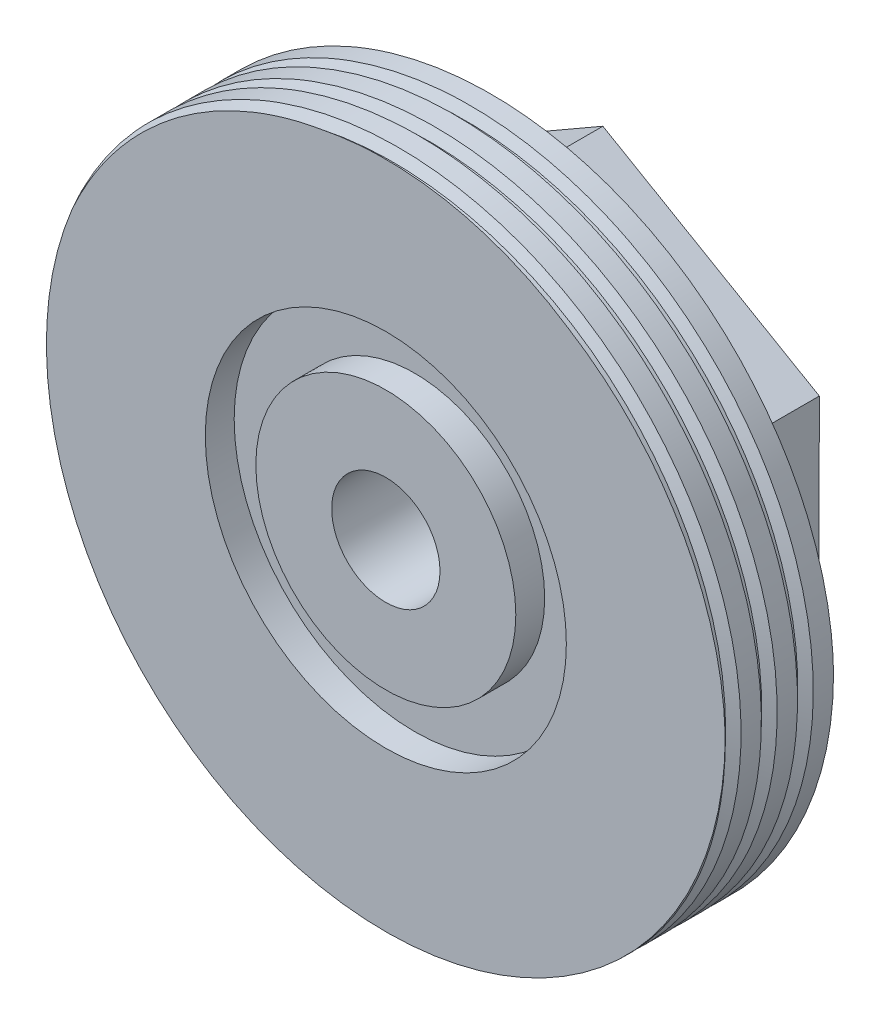
from build123d import *

# Parameters (mm, degrees)
SKETCH3_R           = 14.9225
BOSS_EXTRUDE1_DEPTH = 9.525
SKETCH11_R          = 2.38125
CUT_EXTRUDE3_DEPTH  = 6.35
SKETCH12_R          = 7.9375
SKETCH12_R_2        = 5.715
CUT_EXTRUDE4_DEPTH  = 1.27
THREAD1_PITCH       = 1.5875
CUT_EXTRUDE5_START  = -6.35
SKETCH13_R          = 2.38125
CUT_EXTRUDE5_DEPTH  = 6.35
CUT_EXTRUDE6_START  = -4.7625
SKETCH14_R          = 14.9225
CUT_EXTRUDE6_DEPTH  = 4.7625


with BuildPart() as part:
    # Sketch3 → Boss-Extrude1 (new body)
    with BuildSketch(Plane.XY):
        with Locations((8.347593151, 27.723781851)):
            Circle(SKETCH3_R)
    extrude(amount=-BOSS_EXTRUDE1_DEPTH)

    # Sketch11 → Cut-Extrude3 (cut)
    with BuildSketch(Plane.XY):
        with Locations((8.347593151, 27.723781851)):
            Circle(SKETCH11_R)
    extrude(amount=-CUT_EXTRUDE3_DEPTH, mode=Mode.SUBTRACT)

    # Sketch12 → Cut-Extrude4 (cut)
    with BuildSketch(Plane.XY):
        with Locations((8.347593151, 27.723781851)):
            Circle(SKETCH12_R)
        with Locations((8.347593151, 27.723781851)):
            Circle(SKETCH12_R_2, mode=Mode.SUBTRACT)
    extrude(amount=-CUT_EXTRUDE4_DEPTH, mode=Mode.SUBTRACT)

    # Thread1: the profile of Thread Profile1 profile screwed along a right-hand helix of 4.8 turns, 8 arcs to a turn; built about Z, then put on its axis
    thread1_z = Axis((0, 0, 0), (0, 0, 1))
    thread1_corners = [(14.9228, 0, -0.000173205), (14.9228, 0, 0.694704453), (14.492870212, 0, 0.446484374), (14.492870212, 0, 0.248046874)]
    with BuildLine(mode=Mode.PRIVATE) as thread1_profile:
        Line(thread1_corners[0], thread1_corners[1])
        Line(thread1_corners[1], thread1_corners[2])
        Line(thread1_corners[2], thread1_corners[3])
        Line(thread1_corners[3], thread1_corners[0])
    thread1_cap = Face(thread1_profile.wire())
    thread1_turn_angles = [0, 22.5, 45, 67.5, 90, 112.5, 135, 157.5, 180, 202.5, 225, 247.5, 270, 292.5, 315, 337.5, 360]
    thread1_turn_weights = [1, 0.9238795325112867, 1, 0.9238795325112867, 1, 0.9238795325112867, 1, 0.9238795325112867, 1, 0.9238795325112867, 1, 0.9238795325112867, 1, 0.9238795325112867, 1, 0.9238795325112867, 1]
    thread1_turn_rails = [Edge.make_bspline([Vector(p[0], p[1], 0).rotate(thread1_z, thread1_turn_angles[k]) / thread1_turn_weights[k] + Vector(0, 0, p[2] + THREAD1_PITCH * thread1_turn_angles[k] / 360) for k in range(17)], [0, 0, 0, 1, 1, 2, 2, 3, 3, 4, 4, 5, 5, 6, 6, 7, 7, 8, 8, 8], 2, thread1_turn_weights) for p in thread1_corners]
    thread1_turn_sides = [Face.make_surface_from_curves(thread1_turn_rails[p[0]], thread1_turn_rails[p[1]]) for p in [(0, 1), (1, 2), (2, 3), (3, 0)]]
    thread1_last_angles = [1440, 1462.5, 1485, 1507.5, 1530, 1552.5, 1575, 1597.5, 1620, 1642.5, 1665, 1687.5, 1710, 1719, 1728]
    thread1_last_weights = [1, 0.9238795325112867, 1, 0.9238795325112867, 1, 0.9238795325112867, 1, 0.9238795325112867, 1, 0.9238795325112867, 1, 0.9238795325112867, 1, 0.9876883405951378, 1]
    thread1_last_rails = [Edge.make_bspline([Vector(p[0], p[1], 0).rotate(thread1_z, thread1_last_angles[k]) / thread1_last_weights[k] + Vector(0, 0, p[2] + THREAD1_PITCH * thread1_last_angles[k] / 360) for k in range(15)], [0, 0, 0, 1, 1, 2, 2, 3, 3, 4, 4, 5, 5, 6, 6, 7, 7, 7], 2, thread1_last_weights) for p in thread1_corners]
    thread1_last_sides = [Face.make_surface_from_curves(thread1_last_rails[p[0]], thread1_last_rails[p[1]]) for p in [(0, 1), (1, 2), (2, 3), (3, 0)]]
    thread1 = Plane(origin=(8.347593151, 27.723781851, 0.79375), x_dir=(-1, 0, 0), z_dir=(0, 0, -1)) * Solid(Shell([*[p.moved(Location((0, 0, THREAD1_PITCH * i))) for i in range(4) for p in thread1_turn_sides], *thread1_last_sides, thread1_cap, thread1_cap.rotate(thread1_z, 1728).moved(Location((0, 0, THREAD1_PITCH * 1728 / 360)))]))
    add(thread1, mode=Mode.SUBTRACT)

    # Sketch13 → Cut-Extrude5 (cut)
    with BuildSketch(Plane(origin=(0, 0, -9.525), x_dir=(-1, 0, 0), z_dir=(0, 0, -1)).offset(CUT_EXTRUDE5_START)):
        with Locations(Location((-8.347593151, 27.723781851, 0), (0, 0, 180))):
            Circle(SKETCH13_R)
    extrude(amount=CUT_EXTRUDE5_DEPTH, mode=Mode.SUBTRACT)

    # Sketch14 → Cut-Extrude6 (cut)
    with BuildSketch(Plane(origin=(0, 0, -9.525), x_dir=(-1, 0, 0), z_dir=(0, 0, -1)).offset(CUT_EXTRUDE6_START)):
        with Locations((-8.347593151, 27.723781851)):
            Circle(SKETCH14_R)
        Polygon((1.186658464, 22.240576024), (1.168128197, 33.239083042), (-8.366123418, 38.722288869), (-17.881844766, 33.206987678), (-17.863314499, 22.20848066), (-8.329062884, 16.725274833), align=None, mode=Mode.SUBTRACT)
    extrude(amount=CUT_EXTRUDE6_DEPTH, mode=Mode.SUBTRACT)


solid = part.part
